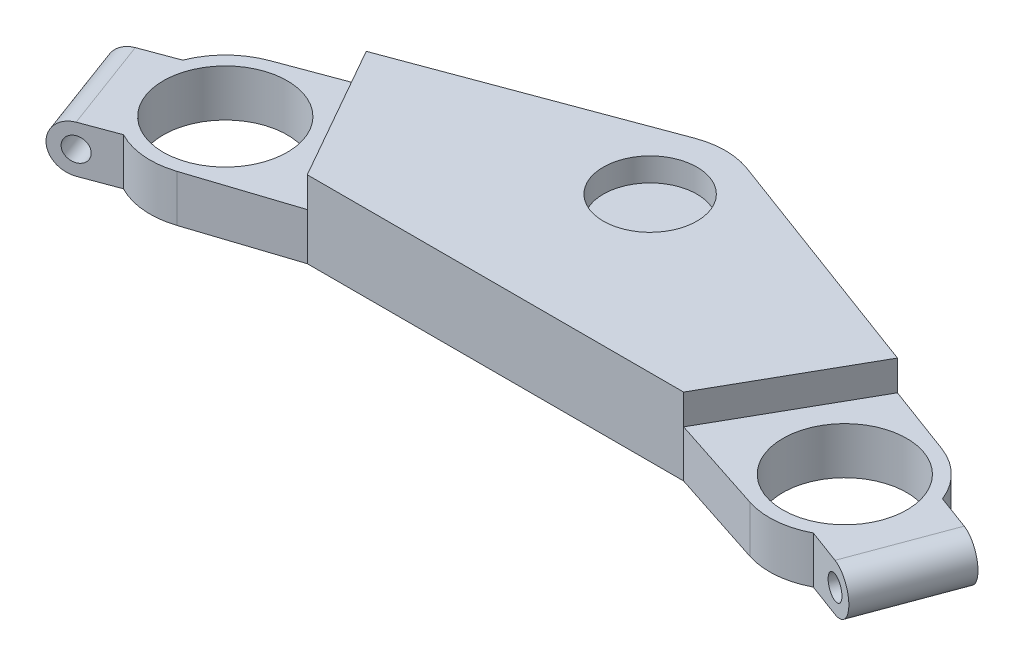
from build123d import *

# Parameters (mm, degrees)
BOSS_EXTRUDE1_DEPTH = 23
SKETCH2_R           = 18.51
CUT_EXTRUDE1_DEPTH  = 131.337270382
SKETCH3_R           = 13.985
CUT_EXTRUDE2_DEPTH  = 7
BOSS_EXTRUDE2_START = -23
BOSS_EXTRUDE2_DEPTH = 23
CUT_EXTRUDE3_DEPTH  = 148.097143868
SKETCH10_R          = 3.5
CUT_EXTRUDE5_DEPTH  = 42
CUT_EXTRUDE8_DEPTH  = 148.097143868
CUT_EXTRUDE9_DEPTH  = 9
SKETCH15_R          = 3.5
CUT_EXTRUDE10_DEPTH = 146.122708378


with BuildPart() as part:
    # Sketch1 → Boss-Extrude1 (new body)
    with BuildSketch(Plane(origin=(0, 0, 0), x_dir=(1, 0, 0), z_dir=(0, 1, 0))):
        with BuildLine():
            Line((-100.336081003, -13.275177251), (-7.836081003, 21.091368721))
            ThreePointArc((-7.836081003, 21.091368721), (0, 22.5), (7.836081003, 21.091368721))
            Line((7.836081003, 21.091368721), (100.336081003, -13.275177251))
            ThreePointArc((100.336081003, -13.275177251), (113.745786388, -41.773742524), (85.524728129, -55.758029845))
            Line((85.524728129, -55.758029845), (56.196116933, -46.194642944))
            Line((56.196116933, -46.194642944), (-56.196116933, -46.194642944))
            Line((-56.196116933, -46.194642944), (-85.524728129, -55.758029845))
            ThreePointArc((-85.524728129, -55.758029845), (-113.745786388, -41.773742524), (-100.336081003, -13.275177251))
        make_face()
    extrude(amount=BOSS_EXTRUDE1_DEPTH)

    # Sketch2 → Cut-Extrude1 (cut, through all)
    with BuildSketch(Plane(origin=(0, 23, 0), x_dir=(1, 0, 0), z_dir=(0, 1, 0))):
        with Locations((-92.5, -34.366545972)):
            Circle(SKETCH2_R)
        with Locations((92.5, -34.366545972)):
            Circle(SKETCH2_R)
    extrude(amount=-CUT_EXTRUDE1_DEPTH, mode=Mode.SUBTRACT)

    # Sketch3 → Cut-Extrude2 (cut)
    with BuildSketch(Plane(origin=(0, 23, 0), x_dir=(1, 0, 0), z_dir=(0, 1, 0))):
        Circle(SKETCH3_R)
    extrude(amount=-CUT_EXTRUDE2_DEPTH, mode=Mode.SUBTRACT)

    # Sketch4 → Boss-Extrude2 (add)
    with BuildSketch(Plane(origin=(0, 23, 0), x_dir=(1, 0, 0), z_dir=(0, 1, 0)).offset(BOSS_EXTRUDE2_START)):
        with BuildLine():
            Line((-113.444632068, -26.146303424), (-132.192515375, -33.11170876))
            Line((-132.192515375, -33.11170876), (-121.744407372, -61.233533721))
            Line((-121.744407372, -61.233533721), (-102.996524064, -54.268128385))
            ThreePointArc((-102.996524064, -54.268128385), (-113.591368721, -42.202626974), (-113.444632068, -26.146303424))
        make_face()
        with BuildLine():
            Line((113.444632068, -26.146303424), (132.192515375, -33.11170876))
            Line((132.192515375, -33.11170876), (121.744407372, -61.233533721))
            Line((121.744407372, -61.233533721), (102.996524064, -54.268128385))
            ThreePointArc((102.996524064, -54.268128385), (113.591368721, -42.202626974), (113.444632068, -26.146303424))
        make_face()
    extrude(amount=BOSS_EXTRUDE2_DEPTH)

    # Sketch5 → Cut-Extrude3 (cut, through all)
    with BuildSketch(Plane(origin=(5.224054002, 0, 14.060912481), x_dir=(0.9373941653717764, 0, -0.3482702667856543), z_dir=(0.3482702667856543, 0, 0.9373941653717764))):
        with BuildLine():
            Line((-135.448316262, 0), (-135.448316262, 14))
            Line((-135.448316262, 14), (-126.448316262, 14))
            ThreePointArc((-126.448316262, 14), (-133.448316262, 7), (-126.448316262, 0))
            Line((-126.448316262, 0), (-135.448316262, 0))
        make_face()
    extrude(amount=-CUT_EXTRUDE3_DEPTH, mode=Mode.SUBTRACT)

    # Sketch10 → Cut-Extrude5 (cut)
    with BuildSketch(Plane(origin=(5.224054002, 0, 14.060912481), x_dir=(0.9373941653717764, 0, -0.3482702667856542), z_dir=(0.3482702667856542, 0, 0.9373941653717764))):
        with Locations((-126.448316262, 7)):
            Circle(SKETCH10_R)
    extrude(amount=-CUT_EXTRUDE5_DEPTH, mode=Mode.SUBTRACT)

    # Sketch13 → Cut-Extrude8 (cut, through all)
    with BuildSketch(Plane(origin=(-5.224054002, 0, 14.060912481), x_dir=(0.9373941653717764, 0, 0.3482702667856543), z_dir=(-0.34827026678565426, 0, 0.9373941653717763))):
        with BuildLine():
            Line((126.448316262, 14), (135.448316262, 14))
            Line((135.448316262, 14), (135.448316262, 0))
            Line((135.448316262, 0), (126.448316262, 0))
            ThreePointArc((126.448316262, 0), (133.448316262, 7), (126.448316262, 14))
        make_face()
    extrude(amount=-CUT_EXTRUDE8_DEPTH, mode=Mode.SUBTRACT)

    # Sketch14 → Cut-Extrude9 (cut)
    with BuildSketch(Plane(origin=(0, 23, 0), x_dir=(1, 0, 0), z_dir=(0, 1, 0))):
        Polygon((-56.196116933, -46.194642944), (-93.033770242, 18.702535116), (-179.483612129, -24.236128073), (-123.538544412, -84.420295749), align=None)
        Polygon((179.483612129, -24.236128073), (123.538544412, -84.420295749), (56.196116933, -46.194642944), (93.033770242, 18.702535116), align=None)
    extrude(amount=-CUT_EXTRUDE9_DEPTH, mode=Mode.SUBTRACT)

    # Sketch15 → Cut-Extrude10 (cut, through all)
    with BuildSketch(Plane(origin=(-5.224054002, 0, 14.060912481), x_dir=(0.9373941653717763, 0, 0.3482702667856543), z_dir=(-0.3482702667856543, 0, 0.9373941653717763))):
        with Locations((126.448316262, 7)):
            Circle(SKETCH15_R)
    extrude(amount=-CUT_EXTRUDE10_DEPTH, mode=Mode.SUBTRACT)


solid = part.part
